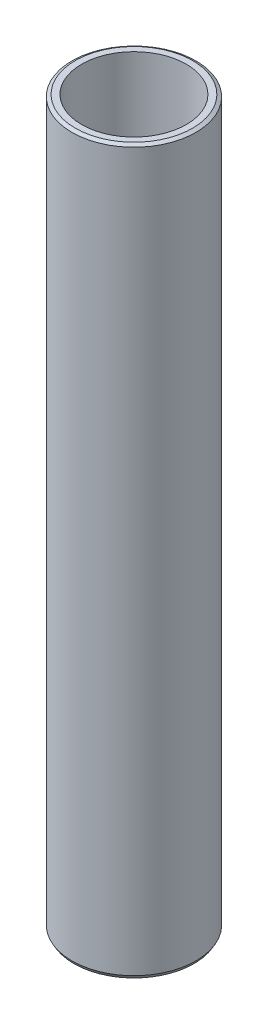
from build123d import *
from OCP.BRepFilletAPI import BRepFilletAPI_MakeChamfer

# Parameters (mm, degrees)
SKETCH1_R           = 40
BOSS_EXTRUDE1_DEPTH = 466.259949835
SKETCH2_R           = 33.762677436
CUT_EXTRUDE1_DEPTH  = 470.678976345
CHAMFER1_SIZE       = 1.257212391
CHAMFER1_SIZE2      = 2.177555737


with BuildPart() as part:
    # Sketch1 → Boss-Extrude1 (new body)
    with BuildSketch(Plane(origin=(0, 0, 0), x_dir=(1, 0, 0), z_dir=(0, 1, 0))):
        Circle(SKETCH1_R)
    extrude(amount=BOSS_EXTRUDE1_DEPTH)

    # Sketch2 → Cut-Extrude1 (cut, through all)
    with BuildSketch(Plane(origin=(0, 0, 0), x_dir=(1, 0, 0), z_dir=(0, 1, 0))):
        Circle(SKETCH2_R)
    extrude(amount=CUT_EXTRUDE1_DEPTH, mode=Mode.SUBTRACT)

    # Chamfer1: one chamfer whose edges measure the first distance from different faces: ONE call of the kernel's chamfer builder (chamfer() names one face for all edges)
    chamfer1_edges_1 = [part.edges().sort_by_distance(p)[0] for p in [
        (-40, 466.259949835, 0),
    ]]
    chamfer1_side_1 = [part.faces().sort_by_distance(p)[0] for p in [
        (-40, 233.129974918, 0),
    ]]
    chamfer1_edges_2 = [part.edges().sort_by_distance(p)[0] for p in [
        (-40, 0, 0),
    ]]
    chamfer1_side_2 = [part.faces().sort_by_distance(p)[0] for p in [
        (-38.86862915, 0, 0),
    ]]
    chamfer1 = BRepFilletAPI_MakeChamfer(part.part.solid().wrapped)
    for e in chamfer1_edges_1:
        chamfer1.Add(CHAMFER1_SIZE, CHAMFER1_SIZE2, e.wrapped, chamfer1_side_1[0].wrapped)  # the first distance lies on this face
    for e in chamfer1_edges_2:
        chamfer1.Add(CHAMFER1_SIZE, CHAMFER1_SIZE2, e.wrapped, chamfer1_side_2[0].wrapped)  # the first distance lies on this face
    add(Compound.cast(chamfer1.Shape()), mode=Mode.REPLACE)


solid = part.part
